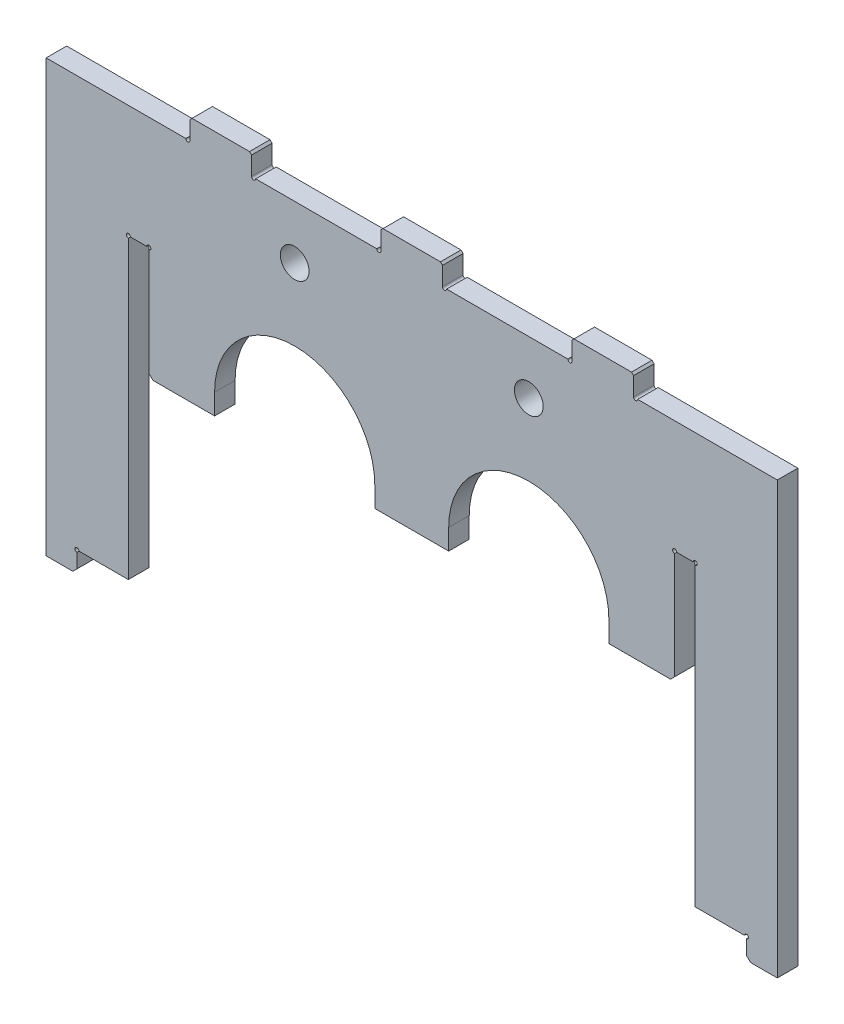
from build123d import *

# Parameters (mm, degrees)
ESQUISSE1_W                               = 256
ESQUISSE1_H                               = 100
T_LE_DE_BASE_PLI_E1_DEPTH                 = 10
ESQUISSE15_W                              = 256
ESQUISSE15_H                              = 10
BOSS_EXTRU_3_DEPTH                        = 10
ENL_V_MAT_EXTRU_1_REACH                   = 277.02
ESQUISSE9_R                               = 39
SKETCH7_W                                 = 10
SKETCH7_H                                 = 55
EXTRUDE2_DEPTH                            = 10
SKETCH8_W                                 = 40
SKETCH8_H                                 = 200
EXTRUDE3_DEPTH                            = 10
ESQUISSE11_W                              = 15
ESQUISSE11_H                              = 10
BOSS_EXTRU_2_DEPTH                        = 10
TROU_POUR_TARAUDAGE_POUR_TROU_TARAUD_M1_D = 14
CHANFREIN1_SIZE                           = 2
TAB_START                                 = -10
TAB_AND_SLOT_TAB1_DEPTH                   = 10
DIAM_TRE_DU_PER_AGE_2_0_2_1_D             = 2
ENL_V_START                               = -10
ESQUISSE19_W                              = 78
ESQUISSE19_H                              = 10
ENL_V_MAT_EXTRU_2_DEPTH                   = 10


# Read off the part's stored shape, not the designer's step: Tab and Slot-Tab1
# Sheet-metal steps are written as plain solids
with BuildPart() as part:
    # Esquisse1 → Tôle de base pliée1 (new body)
    with BuildSketch(Plane.XY):
        with Locations((128, 50)):
            Rectangle(ESQUISSE1_W, ESQUISSE1_H)
    extrude(amount=-T_LE_DE_BASE_PLI_E1_DEPTH)

    # Esquisse15 → Boss.-Extru.3 (add)
    with BuildSketch(Plane.XY):
        with Locations((128, -5)):
            Rectangle(ESQUISSE15_W, ESQUISSE15_H)
    extrude(amount=-BOSS_EXTRU_3_DEPTH)

    # Esquisse9 → Enlèv. mat.-Extru.1 (cut, up to next)
    with BuildSketch(Plane.XY, mode=Mode.PRIVATE) as enl_v_mat_extru_1_sk1:
        with Locations((71, 0)):
            Circle(ESQUISSE9_R)
    enl_v_mat_extru_1_tool1 = extrude(enl_v_mat_extru_1_sk1.sketch, amount=-ENL_V_MAT_EXTRU_1_REACH, mode=Mode.PRIVATE) & part.part
    # Esquisse9 → Enlèv. mat.-Extru.1 (cut, up to next)
    with BuildSketch(Plane.XY, mode=Mode.PRIVATE) as enl_v_mat_extru_1_sk2:
        with Locations((185, 0)):
            Circle(ESQUISSE9_R)
    enl_v_mat_extru_1_tool2 = extrude(enl_v_mat_extru_1_sk2.sketch, amount=-ENL_V_MAT_EXTRU_1_REACH, mode=Mode.PRIVATE) & part.part
    add(enl_v_mat_extru_1_tool1.solids().sort_by_distance((71, 0, 0))[0], mode=Mode.SUBTRACT)
    add(enl_v_mat_extru_1_tool2.solids().sort_by_distance((185, 0, 0))[0], mode=Mode.SUBTRACT)

    # Sketch7 → Extrude2 (add)
    with BuildSketch(Plane.XY):
        with Locations((-5, 72.5)):
            Rectangle(SKETCH7_W, SKETCH7_H)
        with Locations((261, 72.5)):
            Rectangle(SKETCH7_W, SKETCH7_H)
    extrude(amount=-EXTRUDE2_DEPTH)

    # Sketch8 → Extrude3 (add)
    with BuildSketch(Plane.XY):
        with Locations((-30, 0)):
            Rectangle(SKETCH8_W, SKETCH8_H)
        with Locations((286, 0)):
            Rectangle(SKETCH8_W, SKETCH8_H)
    extrude(amount=-EXTRUDE3_DEPTH)

    # Esquisse11 → Boss.-Extru.2 (add)
    with BuildSketch(Plane.XZ.offset(100)):
        with Locations((-42.5, -5)):
            Rectangle(ESQUISSE11_W, ESQUISSE11_H)
        with Locations((298.5, -5)):
            Rectangle(ESQUISSE11_W, ESQUISSE11_H)
    extrude(amount=BOSS_EXTRU_2_DEPTH)

    # Trou pour taraudage pour trou taraudé M161 (through all)
    with Locations(Plane.XY):
        with Locations((71, 74), (185, 74)):
            Hole(TROU_POUR_TARAUDAGE_POUR_TROU_TARAUD_M1_D / 2)

    # Chanfrein1
    chanfrein1_edges = [part.edges().sort_by_distance(p)[0] for p in [
        (-35, -110, -5),
        (291, -110, -5),
        (0, -10, -5),
        (256, -10, -5),
    ]]
    chamfer(chanfrein1_edges, length=CHANFREIN1_SIZE)

    # Tab and Slot-Tab1 outline → Tab and Slot-Tab1 (add)
    with BuildSketch(Plane.XY.offset(TAB_START)):
        Polygon((50, 109), (49, 110), (21, 110), (20, 109), (20, 100), (50, 100), align=None)
        Polygon((206, 109), (206, 100), (236, 100), (236, 109), (235, 110), (207, 110), align=None)
        Polygon((113, 109), (113, 100), (143, 100), (143, 109), (142, 110), (114, 110), align=None)
    extrude(amount=TAB_AND_SLOT_TAB1_DEPTH)

    # Diamètre du perçage Ø2.0 (2)1 (through all)
    with Locations(Plane.XY):
        with Locations((-35, -100)):
            diam_tre_du_per_age_2_0_2_1 = Hole(DIAM_TRE_DU_PER_AGE_2_0_2_1_D / 2)

    # Répét. par esquisse1: Diamètre du perçage Ø2.0 (2)1 at 11 more places
    with Locations((54, 200, 0), (86, 200, 0), (147, 200, 0), (179, 200, 0), (240, 200, 0), (272, 200, 0), (301, 145, 0), (291, 145, 0), (326, 0, 0), (35, 145, 0), (25, 145, 0)):
        add(diam_tre_du_per_age_2_0_2_1, mode=Mode.SUBTRACT)

    # Esquisse19 → Enlèv. mat.-Extru.2 (cut)
    with BuildSketch(Plane.XY.offset(ENL_V_START)):
        with Locations((71, -5)):
            Rectangle(ESQUISSE19_W, ESQUISSE19_H)
        with Locations((185, -5)):
            Rectangle(ESQUISSE19_W, ESQUISSE19_H)
    extrude(amount=ENL_V_MAT_EXTRU_2_DEPTH, mode=Mode.SUBTRACT)


solid = part.part
